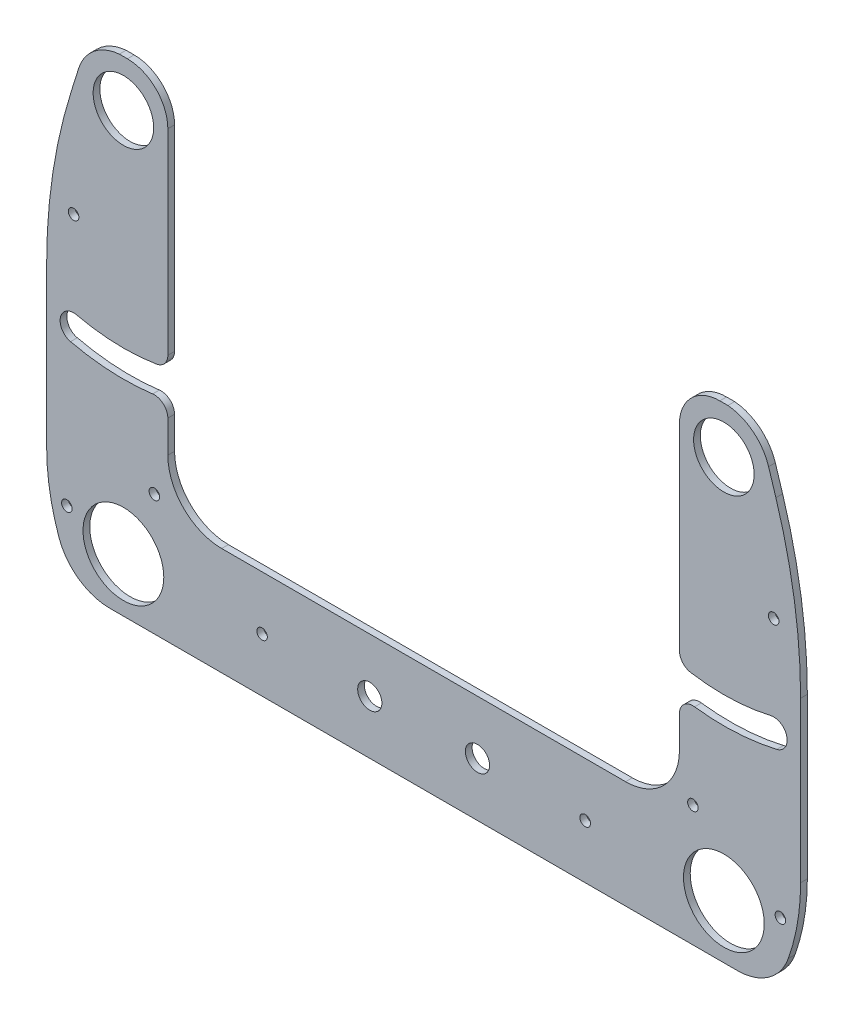
from build123d import *

# Parameters (mm, degrees)
SKETCH1_R           = 14.2875
SKETCH1_R_2         = 19.05
SKETCH1_R_3         = 2.4892
SKETCH1_R_4         = 5.715
BOSS_EXTRUDE3_DEPTH = 3.175
SKETCH2_W           = 355.6
SKETCH2_H           = 19.05
CUT_EXTRUDE1_DEPTH  = 290.621961572
FILLET1_R           = 19.05
CUT_EXTRUDE2_DEPTH  = 290.621961572
FILLET2_R           = 254
CUT_EXTRUDE3_DEPTH  = 290.621961572
FILLET3_R           = 25.4
CUT_EXTRUDE4_DEPTH  = 290.621961572
FILLET4_R           = 6.35


with BuildPart() as part:
    # Sketch1 → Boss-Extrude3 (new body)
    with BuildSketch(Plane.XY):
        with BuildLine():
            Line((120.65, -152.4), (120.65, -6.35))
            Line((120.65, -6.35), (120.65, 6.35))
            ThreePointArc((120.65, 6.35), (124.369743879, 15.330256121), (133.35, 19.05))
            Line((133.35, 19.05), (165.1, 19.05))
            ThreePointArc((165.1, 19.05), (174.080256121, 15.330256121), (177.8, 6.35))
            Line((177.8, 6.35), (177.8, -6.35))
            Line((177.8, -6.35), (177.8, -222.25))
            ThreePointArc((177.8, -222.25), (175.940128061, -226.740128061), (171.45, -228.6))
            Line((171.45, -228.6), (12.7, -228.6))
            Line((12.7, -228.6), (-12.7, -228.6))
            Line((-12.7, -228.6), (-171.45, -228.6))
            ThreePointArc((-171.45, -228.6), (-175.940128061, -226.740128061), (-177.8, -222.25))
            Line((-177.8, -222.25), (-177.8, -6.35))
            Line((-177.8, -6.35), (-177.8, 6.35))
            ThreePointArc((-177.8, 6.35), (-174.080256121, 15.330256121), (-165.1, 19.05))
            Line((-165.1, 19.05), (-133.35, 19.05))
            ThreePointArc((-133.35, 19.05), (-124.369743879, 15.330256121), (-120.65, 6.35))
            Line((-120.65, 6.35), (-120.65, -6.35))
            Line((-120.65, -6.35), (-120.65, -152.4))
            ThreePointArc((-120.65, -152.4), (-113.210512242, -170.360512242), (-95.25, -177.8))
            Line((-95.25, -177.8), (-12.7, -177.8))
            Line((-12.7, -177.8), (12.7, -177.8))
            Line((12.7, -177.8), (95.25, -177.8))
            ThreePointArc((95.25, -177.8), (113.210512242, -170.360512242), (120.65, -152.4))
        make_face()
        with Locations((141.605, -22.02688)):
            Circle(SKETCH1_R, mode=Mode.SUBTRACT)
        with Locations((-141.605, -22.02688)):
            Circle(SKETCH1_R, mode=Mode.SUBTRACT)
        with Locations((-141.605, -203.2)):
            Circle(SKETCH1_R_2, mode=Mode.SUBTRACT)
        with Locations((141.605, -203.2)):
            Circle(SKETCH1_R_2, mode=Mode.SUBTRACT)
        with Locations((-76.2, -203.2)):
            Circle(SKETCH1_R_3, mode=Mode.SUBTRACT)
        with Locations((76.2, -203.2)):
            Circle(SKETCH1_R_3, mode=Mode.SUBTRACT)
        with Locations((-25.4, -203.2)):
            Circle(SKETCH1_R_4, mode=Mode.SUBTRACT)
        with Locations((-149.225, 6.35)):
            Circle(SKETCH1_R_3, mode=Mode.SUBTRACT)
        with Locations((149.225, 6.35)):
            Circle(SKETCH1_R_3, mode=Mode.SUBTRACT)
        with Locations((-168.275, -196.85)):
            Circle(SKETCH1_R_3, mode=Mode.SUBTRACT)
        with Locations((168.275, -196.85)):
            Circle(SKETCH1_R_3, mode=Mode.SUBTRACT)
        with Locations((-165.1, -76.2)):
            Circle(SKETCH1_R_3, mode=Mode.SUBTRACT)
        with Locations((165.1, -76.2)):
            Circle(SKETCH1_R_3, mode=Mode.SUBTRACT)
        with Locations((-127, -171.45)):
            Circle(SKETCH1_R_3, mode=Mode.SUBTRACT)
        with Locations((127, -171.45)):
            Circle(SKETCH1_R_3, mode=Mode.SUBTRACT)
        with Locations((25.4, -203.2)):
            Circle(SKETCH1_R_4, mode=Mode.SUBTRACT)
    extrude(amount=BOSS_EXTRUDE3_DEPTH)

    # Sketch2 → Cut-Extrude1 (cut, through all)
    with BuildSketch(Plane.XY.offset(3.175)):
        with Locations((0, 9.525)):
            Rectangle(SKETCH2_W, SKETCH2_H)
    extrude(amount=-CUT_EXTRUDE1_DEPTH, mode=Mode.SUBTRACT)

    # Fillet1
    fillet1_edges = [part.edges().sort_by_distance(p)[0] for p in [
        (177.8, 0, 1.5875),
        (120.65, 0, 1.5875),
        (-120.65, 0, 1.5875),
        (-177.8, 0, 1.5875),
    ]]
    fillet(fillet1_edges, radius=FILLET1_R)

    # Sketch3 → Cut-Extrude2 (cut, through all)
    with BuildSketch(Plane.XY.offset(3.175)):
        with BuildLine():
            Line((-177.8, -63.5), (-162.698792053, -15.403859213))
            ThreePointArc((-162.698792053, -15.403859213), (-155.445369527, -4.785747819), (-143.51, 0))
            Line((-143.51, 0), (-177.8, 0))
            Line((-177.8, 0), (-177.8, -63.5))
        make_face()
    cut_extrude2 = extrude(amount=-CUT_EXTRUDE2_DEPTH, mode=Mode.SUBTRACT)

    # Mirror1: Cut-Extrude2 across plane
    add(cut_extrude2.mirror(Plane.ZY), mode=Mode.SUBTRACT)

    # Fillet2
    fillet2_edges = [part.edges().sort_by_distance(p)[0] for p in [
        (177.8, -63.5, 1.5875),
        (-177.8, -63.5, 1.5875),
    ]]
    fillet(fillet2_edges, radius=FILLET2_R)

    # Sketch4 → Cut-Extrude3 (cut, through all)
    with BuildSketch(Plane.XY.offset(3.175)):
        with BuildLine():
            Line((-177.8, -177.8), (-177.8, -228.6))
            Line((-177.8, -228.6), (-164.188181024, -228.6))
            ThreePointArc((-164.188181024, -228.6), (-174.338063951, -204.096014982), (-177.8, -177.8))
        make_face()
        with BuildLine():
            Line((177.8, -177.8), (177.8, -228.6))
            Line((177.8, -228.6), (164.188181024, -228.6))
            ThreePointArc((164.188181024, -228.6), (174.338063951, -204.096014982), (177.8, -177.8))
        make_face()
    extrude(amount=-CUT_EXTRUDE3_DEPTH, mode=Mode.SUBTRACT)

    # Fillet3
    fillet3_edges = [part.edges().sort_by_distance(p)[0] for p in [
        (164.188181024, -228.6, 1.5875),
        (-164.188181024, -228.6, 1.5875),
    ]]
    fillet(fillet3_edges, radius=FILLET3_R)

    # Sketch5 → Cut-Extrude4 (cut, through all)
    with BuildSketch(Plane.XY.offset(3.175)):
        with BuildLine():
            Line((-120.65, -129.796193121), (-120.65, -116.826181287))
            ThreePointArc((-120.65, -116.826181287), (-142.167804376, -119.112938735), (-163.657650988, -116.576867488))
            ThreePointArc((-163.657650988, -116.576867488), (-171.284022099, -121.318540575), (-166.542349012, -128.944911687))
            ThreePointArc((-166.542349012, -128.944911687), (-143.641159604, -131.795686724), (-120.65, -129.796193121))
        make_face()
        with BuildLine():
            Line((120.65, -129.796193121), (120.65, -116.826181287))
            ThreePointArc((120.65, -116.826181287), (142.167804376, -119.112938735), (163.657650988, -116.576867488))
            ThreePointArc((163.657650988, -116.576867488), (171.284022099, -121.318540575), (166.542349012, -128.944911687))
            ThreePointArc((166.542349012, -128.944911687), (143.641159604, -131.795686724), (120.65, -129.796193121))
        make_face()
    extrude(amount=-CUT_EXTRUDE4_DEPTH, mode=Mode.SUBTRACT)

    # Fillet4
    fillet4_edges = [part.edges().sort_by_distance(p)[0] for p in [
        (120.65, -129.796193121, 1.5875),
        (120.65, -116.826181287, 1.5875),
        (-120.65, -129.796193121, 1.5875),
        (-120.65, -116.826181287, 1.5875),
    ]]
    fillet(fillet4_edges, radius=FILLET4_R)


solid = part.part
